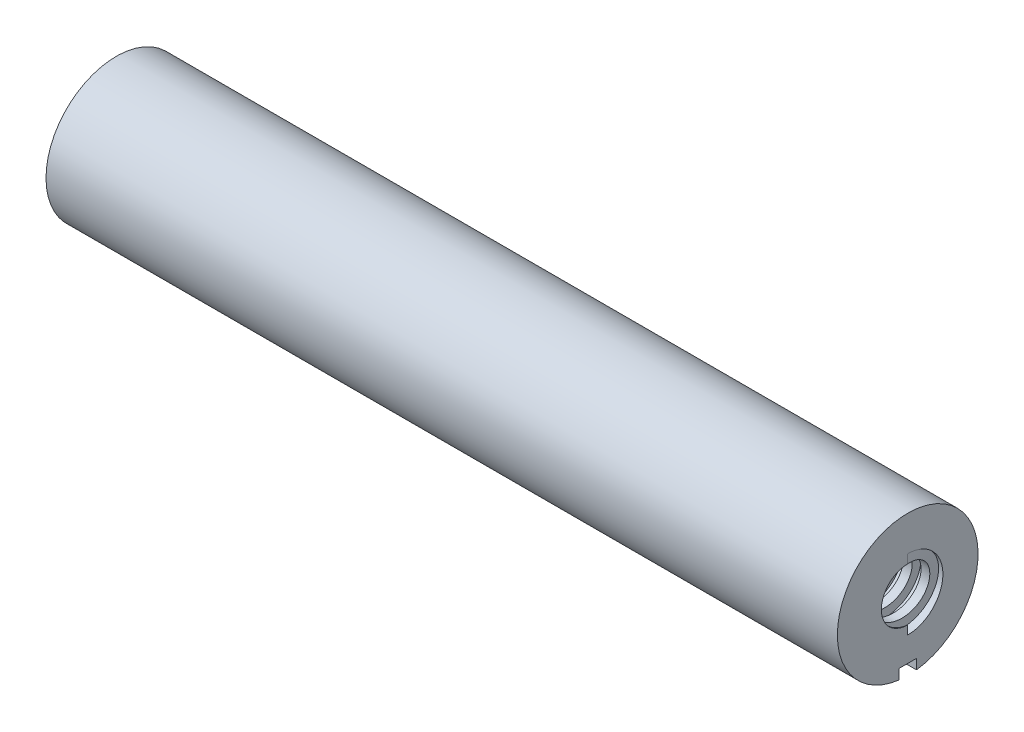
from build123d import *

# Parameters (mm, degrees)
CUT_SWEEP1_PITCH   = 5
SKETCH4_W          = 5
SKETCH4_H          = 6
CUT_EXTRUDE1_DEPTH = 205


with BuildPart() as part:
    # Sketch1 → Revolve1 (revolve)
    with BuildSketch(Plane.XY, mode=Mode.PRIVATE) as revolve1_sk:
        Polygon((0, 10), (0, 20), (225, 20), (225, 7.5), (180, 7.5), (180, 11), (40, 11), (40, 9), align=None)
    revolve(revolve1_sk.sketch.rotate(Axis((0, 0, 0), (1, 0, 0)), 90), axis=Axis((0, 0, 0), (1, 0, 0)))

    # Cut-Sweep1: the profile of Sketch3 screwed along a right-hand helix of 11.75 turns, 12 arcs to a turn; built about Z, then put on its axis
    cut_sweep1_z = Axis((0, 0, 0), (0, 0, 1))
    cut_sweep1_corners = [(5, 0.131888801, -1.243022664), (5, -0.131888801, 1.243022664), (10, -0.131888801, 1.243022664), (10, 0.131888801, -1.243022664)]
    with BuildLine(mode=Mode.PRIVATE) as cut_sweep1_profile:
        Line(cut_sweep1_corners[0], cut_sweep1_corners[1])
        Line(cut_sweep1_corners[1], cut_sweep1_corners[2])
        Line(cut_sweep1_corners[2], cut_sweep1_corners[3])
        Line(cut_sweep1_corners[3], cut_sweep1_corners[0])
    cut_sweep1_cap = Face(cut_sweep1_profile.wire())
    cut_sweep1_turn_angles = [0, 15, 30, 45, 60, 75, 90, 105, 120, 135, 150, 165, 180, 195, 210, 225, 240, 255, 270, 285, 300, 315, 330, 345, 360]
    cut_sweep1_turn_weights = [1, 0.9659258262890683, 1, 0.9659258262890683, 1, 0.9659258262890683, 1, 0.9659258262890683, 1, 0.9659258262890683, 1, 0.9659258262890683, 1, 0.9659258262890683, 1, 0.9659258262890683, 1, 0.9659258262890683, 1, 0.9659258262890683, 1, 0.9659258262890683, 1, 0.9659258262890683, 1]
    cut_sweep1_turn_rails = [Edge.make_bspline([Vector(p[0], p[1], 0).rotate(cut_sweep1_z, cut_sweep1_turn_angles[k]) / cut_sweep1_turn_weights[k] + Vector(0, 0, p[2] + CUT_SWEEP1_PITCH * cut_sweep1_turn_angles[k] / 360) for k in range(25)], [0, 0, 0, 1, 1, 2, 2, 3, 3, 4, 4, 5, 5, 6, 6, 7, 7, 8, 8, 9, 9, 10, 10, 11, 11, 12, 12, 12], 2, cut_sweep1_turn_weights) for p in cut_sweep1_corners]
    cut_sweep1_turn_sides = [Face.make_surface_from_curves(cut_sweep1_turn_rails[p[0]], cut_sweep1_turn_rails[p[1]]) for p in [(0, 1), (1, 2), (2, 3), (3, 0)]]
    cut_sweep1_last_angles = [3960, 3975, 3990, 4005, 4020, 4035, 4050, 4065, 4080, 4095, 4110, 4125, 4140, 4155, 4170, 4185, 4200, 4215, 4230]
    cut_sweep1_last_weights = [1, 0.9659258262890683, 1, 0.9659258262890683, 1, 0.9659258262890683, 1, 0.9659258262890683, 1, 0.9659258262890683, 1, 0.9659258262890683, 1, 0.9659258262890683, 1, 0.9659258262890683, 1, 0.9659258262890478, 1]
    cut_sweep1_last_rails = [Edge.make_bspline([Vector(p[0], p[1], 0).rotate(cut_sweep1_z, cut_sweep1_last_angles[k]) / cut_sweep1_last_weights[k] + Vector(0, 0, p[2] + CUT_SWEEP1_PITCH * cut_sweep1_last_angles[k] / 360) for k in range(19)], [0, 0, 0, 1, 1, 2, 2, 3, 3, 4, 4, 5, 5, 6, 6, 7, 7, 8, 8, 9, 9, 9], 2, cut_sweep1_last_weights) for p in cut_sweep1_corners]
    cut_sweep1_last_sides = [Face.make_surface_from_curves(cut_sweep1_last_rails[p[0]], cut_sweep1_last_rails[p[1]]) for p in [(0, 1), (1, 2), (2, 3), (3, 0)]]
    cut_sweep1 = Plane(origin=(235, 0, 0), x_dir=(0, 0, -1), z_dir=(-1, 0, 0)) * Solid(Shell([*[p.moved(Location((0, 0, CUT_SWEEP1_PITCH * i))) for i in range(11) for p in cut_sweep1_turn_sides], *cut_sweep1_last_sides, cut_sweep1_cap, cut_sweep1_cap.rotate(cut_sweep1_z, 4230).moved(Location((0, 0, CUT_SWEEP1_PITCH * 4230 / 360)))]))
    add(cut_sweep1, mode=Mode.SUBTRACT)

    # Sketch4 → Cut-Extrude1 (cut)
    with BuildSketch(Plane(origin=(225, 0, 0), x_dir=(0, 0, -1), z_dir=(1, 0, 0))):
        with Locations((0, -20)):
            Rectangle(SKETCH4_W, SKETCH4_H)
    extrude(amount=-CUT_EXTRUDE1_DEPTH, mode=Mode.SUBTRACT)


solid = part.part
